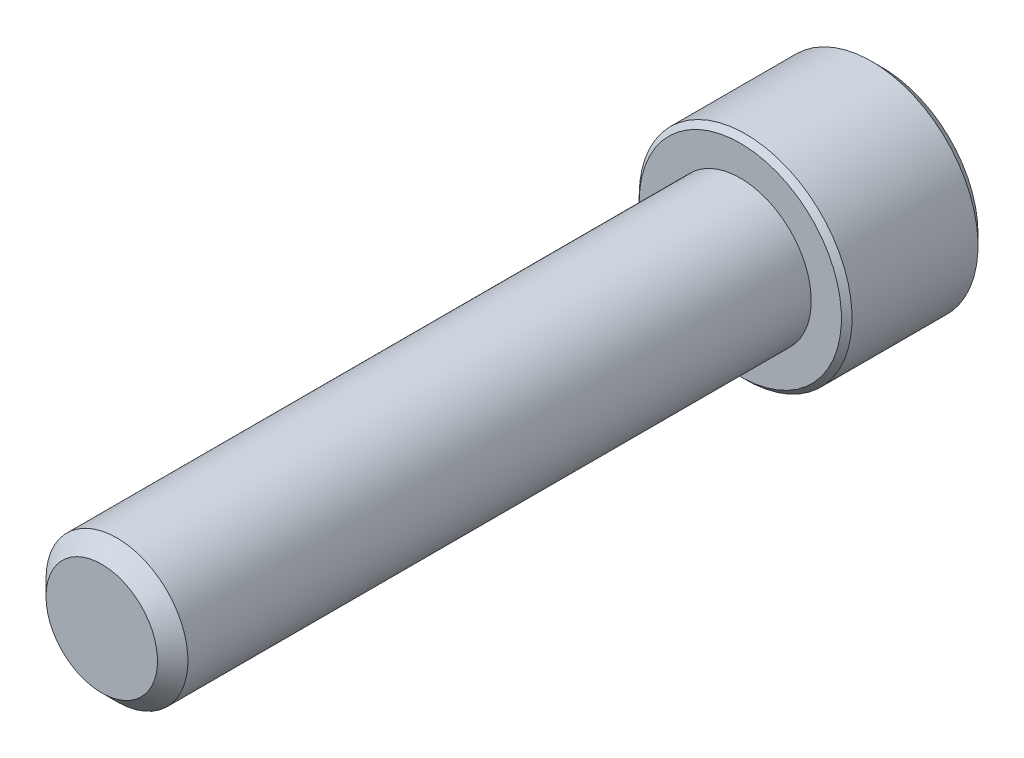
from build123d import *

# Parameters (mm, degrees)
SKETCH1_R          = 3.175
EXTRUDE1_DEPTH     = 28.575
CHAMFER3_SIZE      = 0.680357143
SKETCH6_R          = 4.7625
EXTRUDE2_DEPTH     = 6.35
CUT_EXTRUDE1_DEPTH = 3.571875
CHAMFER1_SIZE      = 0.47625
CHAMFER2_SIZE      = 0.238125


with BuildPart() as part:
    # Sketch1 → Extrude1 (new body)
    with BuildSketch(Plane.XY):
        Circle(SKETCH1_R)
    extrude(amount=-EXTRUDE1_DEPTH)

    # Chamfer3
    chamfer3_edges = [part.edges().sort_by_distance(p)[0] for p in [
        (-3.175, 0, 0),
    ]]
    chamfer(chamfer3_edges, length=CHAMFER3_SIZE)

    # Sketch6 → Extrude2 (add)
    with BuildSketch(Plane(origin=(0, 0, -28.575), x_dir=(-1, 0, 0), z_dir=(0, 0, -1))):
        Circle(SKETCH6_R)
    extrude(amount=EXTRUDE2_DEPTH)

    # Sketch7 → Cut-Extrude1 (cut)
    with BuildSketch(Plane(origin=(0, 0, -34.925), x_dir=(-1, 0, 0), z_dir=(0, 0, -1))):
        Polygon((0, 2.749630657), (-2.38125, 1.374815329), (-2.38125, -1.374815329), (0, -2.749630657), (2.38125, -1.374815329), (2.38125, 1.374815329), align=None)
    extrude(amount=-CUT_EXTRUDE1_DEPTH, mode=Mode.SUBTRACT)

    # Cut-Extrude2 cone 1 section (through the dimple's axis) → Cut-Extrude2 (revolve, cut)
    with BuildSketch(Plane(origin=(0, 0, -34.925), x_dir=(0, 1, 0), z_dir=(1, 0, 0))):
        Polygon((0, 0), (2.749630657, 0), (0, 2.749630657), align=None)
    revolve(axis=Axis((0, 0, -34.925), (0, 0, 1)), mode=Mode.SUBTRACT)

    # Chamfer1
    chamfer1_edges = [part.edges().sort_by_distance(p)[0] for p in [
        (4.7625, 0, -34.925),
    ]]
    chamfer(chamfer1_edges, length=CHAMFER1_SIZE)

    # Chamfer2
    chamfer2_edges = [part.edges().sort_by_distance(p)[0] for p in [
        (4.7625, 0, -28.575),
    ]]
    chamfer(chamfer2_edges, length=CHAMFER2_SIZE)


solid = part.part
